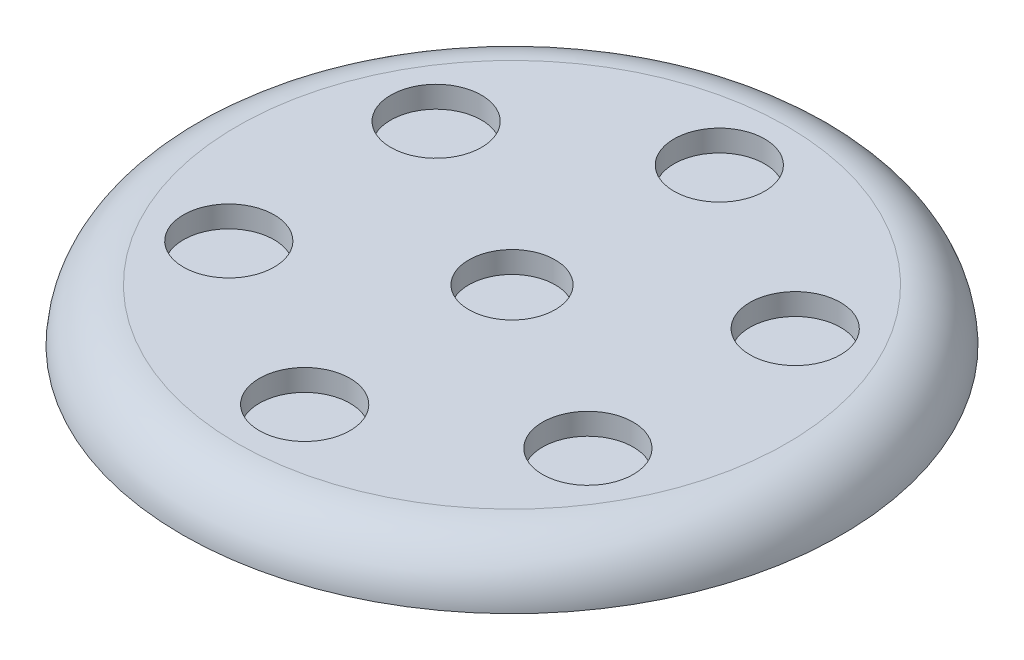
from build123d import *

# Parameters (mm, degrees)
ESQUISSE1_R             = 76.3
BOSS_EXTRU_1_DEPTH      = 12
CONG_1_R                = 12.7
ESQUISSE2_R             = 10
ESQUISSE2_R_2           = 10.5
ENL_V_MAT_EXTRU_1_DEPTH = 5


with BuildPart() as part:
    # Esquisse1 → Boss.-Extru.1 (new body)
    with BuildSketch(Plane(origin=(0, 0, 0), x_dir=(1, 0, 0), z_dir=(0, 1, 0))):
        with Locations(Location((0, 0, 0), (0, 0, 270))):
            Circle(ESQUISSE1_R)
    extrude(amount=BOSS_EXTRU_1_DEPTH)

    # Congé1
    # the kernel refuses this fillet: 12.7 mm, written as the material it takes off along each edge
    with BuildSketch(Plane(origin=(0, 12, 0), x_dir=(0, 0, 1), z_dir=(-1, 0, 0))) as cong_1_piece_1:
        with BuildLine():
            CenterArc((63.619306013, -12.7), CONG_1_R, 3.159636303, 86.840363697)
            Line((63.619306013, 0), (63.619306013, 0.254))
            Line((63.619306013, 0.254), (76.3, 0.254))
            Line((76.3, 0.254), (76.554, 0))
            ThreePointArc((76.554, 0), (76.554, -6), (76.55361388, -11.986))
            Line((76.55361388, -11.986), (76.3, -12))
        make_face()
    revolve(axis=Axis((0, 12, 0), (0, 1, 0)), mode=Mode.SUBTRACT)

    # Esquisse2 → Enlèv. mat.-Extru.1 (cut)
    with BuildSketch(Plane(origin=(0, 12, 0), x_dir=(1, 0, 0), z_dir=(0, 1, 0))):
        with Locations(Location((0, 0, 0), (0, 0, 270))):
            Circle(ESQUISSE2_R)
        with Locations(Location((0, 48, 0), (0, 0, 270))):
            Circle(ESQUISSE2_R_2)
        with Locations(Location((41.569219382, 24, 0), (0, 0, 270))):
            Circle(ESQUISSE2_R_2)
        with Locations(Location((41.569219382, -24, 0), (0, 0, 270))):
            Circle(ESQUISSE2_R_2)
        with Locations(Location((0, -48, 0), (0, 0, 270))):
            Circle(ESQUISSE2_R_2)
        with Locations(Location((-41.569219382, -24, 0), (0, 0, 270))):
            Circle(ESQUISSE2_R_2)
        with Locations(Location((-41.569219382, 24, 0), (0, 0, 270))):
            Circle(ESQUISSE2_R_2)
    extrude(amount=-ENL_V_MAT_EXTRU_1_DEPTH, mode=Mode.SUBTRACT)


solid = part.part
